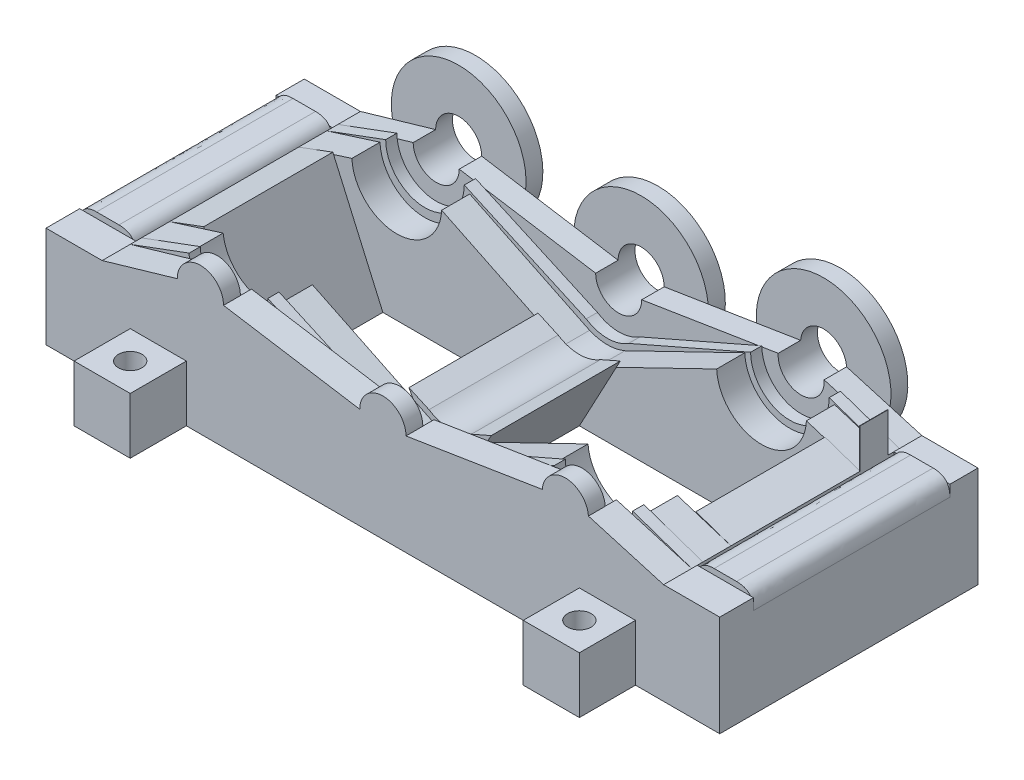
from build123d import *
from build123d.topology import SkipClean

# Parameters (mm, degrees)
SKETCH_1_5_W              = 10
SKETCH_1_5_H              = 10
SKETCH_1_5_R              = 2.1
EXTRUDE_4_DEPTH           = 10
EXTRUDE_4_2_DEPTH         = 10
SKETCH_1_6_W              = 10
SKETCH_1_6_H              = 10
SKETCH_1_6_R              = 2.1
EXTRUDE_5_DEPTH           = 35
SKETCH_1_W                = 10
SKETCH_1_H                = 35
EXTRUDE_7_DEPTH           = 19
EXTRUDE_7_2_DEPTH         = 19
FILLET_8_SIZE             = 3
FILLET_9_SIZE             = 3
EXTRUDE_8_DEPTH           = 18
SKETCH_2_W                = 37
SKETCH_2_H                = 30
CUT_EXTRUDE_2_DEPTH       = 138.800580637
CUT_EXTRUDE_3_DEPTH       = 113.111551644
CUT_EXTRUDE_3_DEPTH_BACK  = 113.111551644
CUT_EXTRUDE_6_DEPTH       = 138.800580637
CUT_EXTRUDE_6_DEPTH_BACK  = 138.800580637
EXTRUDE_START             = 3
SKETCH_13_R               = 12
SKETCH_13_R_2             = 4.1
SKETCH_13_R_3             = 4.10000036
EXTRUDE_20_DEPTH          = 3
CUT_EXTRUDE_9_DEPTH       = 40
EXTRUDE_21_DEPTH          = 5
CUT_EXTRUDE_10_DEPTH      = 5
EXTRUDE_START_2           = -6
EXTRUDE_22_DEPTH          = 6
CUT_EXTRUDE_START         = -6
CUT_EXTRUDE_11_DEPTH      = 6
SKETCH_16_R               = 4.12
EXTRUDE_45_DEPTH          = 3
CUT_EXTRUDE_12_DEPTH      = 36
CUT_EXTRUDE_12_DEPTH_BACK = 1
SKETCH_19_W               = 100
SKETCH_19_H               = 5
EXTRUDE_46_DEPTH          = 25
SKETCH_21_R               = 8
SKETCH_21_R_2             = 7.990611724
CUT_EXTRUDE_15_DEPTH      = 5
SKETCH_22_R               = 8
CUT_EXTRUDE_16_DEPTH      = 5
SKETCH_19_4_W             = 100
SKETCH_19_4_H             = 2
EXTRUDE_47_DEPTH          = 25
CUT_EXTRUDE_START_2       = -2
CUT_EXTRUDE_18_DEPTH      = 2
SKETCH_19_6_W             = 100
SKETCH_19_6_H             = 23
SKETCH_19_6_H_2           = 2
EXTRUDE_49_DEPTH          = 25
CUT_EXTRUDE_START_3       = -23
CUT_EXTRUDE_20_DEPTH      = 23
SKETCH_26_R               = 7
CUT_EXTRUDE_21_DEPTH      = 2
CUT_EXTRUDE_22_DEPTH      = 23


with BuildPart() as part:
    # Эскиз1<5> → Бобышка-Вытянуть4 (new body)
    with BuildSketch(Plane(origin=(0, 0, 0), x_dir=(1, 0, 0), z_dir=(0, 1, 0))):
        with Locations((-40, -35)):
            Rectangle(SKETCH_1_5_W, SKETCH_1_5_H)
        with Locations(Location((-40, -35, 0), (0, 0, 270))):
            Circle(SKETCH_1_5_R, mode=Mode.SUBTRACT)
    extrude(amount=EXTRUDE_4_DEPTH)



with BuildPart() as body_2:
    # Эскиз1<5> → Extrude 4 2 (new body)
    with BuildSketch(Plane(origin=(0, 0, 0), x_dir=(1, 0, 0), z_dir=(0, 1, 0))):
        with Locations((40, -35)):
            Rectangle(SKETCH_1_5_W, SKETCH_1_5_H)
        with Locations(Location((40, -35, 0), (0, 0, 270))):
            Circle(SKETCH_1_5_R, mode=Mode.SUBTRACT)
    extrude(amount=EXTRUDE_4_2_DEPTH)


with BuildPart() as body_3:
    # Эскиз1<6> → Бобышка-Вытянуть5 (new body)
    # profile 1 of 3: a face of its own
    with BuildSketch(Plane(origin=(0, 0, 0), x_dir=(1, 0, 0), z_dir=(0, 1, 0))):
        Polygon((45, 48), (35, 48), (-35, 48), (-45, 48), (-60, 48), (-60, 43), (-60, 16), (-55, 16), (-55, 43), (55, 43), (55, 16), (60, 16), (60, 43), (60, 48), align=None)
    # profile 2 of 3: a face of its own
    with BuildSketch(Plane(origin=(0, 0, 0), x_dir=(1, 0, 0), z_dir=(0, 1, 0))):
        with Locations((-40, 53)):
            Rectangle(SKETCH_1_6_W, SKETCH_1_6_H)
        with Locations(Location((-40, 53, 0), (0, 0, 270))):
            Circle(SKETCH_1_6_R, mode=Mode.SUBTRACT)
    # profile 3 of 3: a face of its own
    with BuildSketch(Plane(origin=(0, 0, 0), x_dir=(1, 0, 0), z_dir=(0, 1, 0))):
        with Locations((40, 53)):
            Rectangle(SKETCH_1_6_W, SKETCH_1_6_H)
        with Locations(Location((40, 53, 0), (0, 0, 270))):
            Circle(SKETCH_1_6_R, mode=Mode.SUBTRACT)
    extrude(amount=EXTRUDE_5_DEPTH)


with BuildPart() as body_4:
    # Эскиз1 → Бобышка-Вытянуть7 (new body)
    with BuildSketch(Plane(origin=(0, 0, 0), x_dir=(1, 0, 0), z_dir=(0, 1, 0))):
        with Locations((55, -6.5)):
            Rectangle(SKETCH_1_W, SKETCH_1_H)
    extrude(amount=EXTRUDE_7_DEPTH)

    # Скругление9
    # a fillet whose section is not a circle: 3 mm, written as the material it takes off along each edge
    with BuildSketch(Plane(origin=(50, 19, 31.5), x_dir=(0, -1, 0), z_dir=(0, 0, -1)), Plane(origin=(60, 19, -18.5), x_dir=(0, -1, 0), z_dir=(0, 0, 1))) as fillet_9_piece_1:
        with BuildLine():
            Bezier((FILLET_9_SIZE, 0), (0, 0), (0, -FILLET_9_SIZE), weights=[1, 1, 1])
            Line((0, -FILLET_9_SIZE), (0, 0))
            Line((0, 0), (FILLET_9_SIZE, 0))
        make_face()
    extrude(amount=50, mode=Mode.SUBTRACT)


with BuildPart() as body_5:
    # Эскиз1 → Extrude 7 2 (new body)
    with BuildSketch(Plane(origin=(0, 0, 0), x_dir=(1, 0, 0), z_dir=(0, 1, 0))):
        with Locations((-55, -6.5)):
            Rectangle(SKETCH_1_W, SKETCH_1_H)
    extrude(amount=EXTRUDE_7_2_DEPTH)

    # Скругление8
    # a fillet whose section is not a circle: 3 mm, written as the material it takes off along each edge
    with BuildSketch(Plane(origin=(-60, 19, -18.5), x_dir=(0, -1, 0), z_dir=(0, 0, 1)), Plane(origin=(-50, 19, 31.5), x_dir=(0, -1, 0), z_dir=(0, 0, -1))) as fillet_8_piece_1:
        with BuildLine():
            Bezier((FILLET_8_SIZE, 0), (0, 0), (0, FILLET_8_SIZE), weights=[1, 1, 1])
            Line((0, FILLET_8_SIZE), (0, 0))
            Line((0, 0), (FILLET_8_SIZE, 0))
        make_face()
    extrude(amount=50, mode=Mode.SUBTRACT)


with BuildPart() as part_1:
    add(part.part)

    add(body_2.part)  # Бобышка-Вытянуть8 merges body 2

    add(body_3.part)  # Бобышка-Вытянуть8 merges body 3

    add(body_4.part)  # Бобышка-Вытянуть8 merges body 4

    add(body_5.part)  # Бобышка-Вытянуть8 merges body 5
    # Эскиз1<9> → Бобышка-Вытянуть8 (add)
    with BuildSketch(Plane(origin=(0, 0, 0), x_dir=(1, 0, 0), z_dir=(0, 1, 0))):
        Polygon((-50, 11), (50, 11), (60, 11), (60, 16), (55, 16), (-55, 16), (-60, 16), (-60, 11), align=None)
        Polygon((50, -24), (60, -24), (60, -30), (45, -30), (35, -30), (-35, -30), (-45, -30), (-60, -30), (-60, -24), (-50, -24), align=None)
    extrude(amount=EXTRUDE_8_DEPTH)

    # Эскиз2 → Вырез-Вытянуть2 (cut, through all)
    with BuildSketch(Plane.ZY.offset(60)):
        with Locations((-39.5, 15)):
            Rectangle(SKETCH_2_W, SKETCH_2_H)
    extrude(amount=-CUT_EXTRUDE_2_DEPTH, mode=Mode.SUBTRACT)

    # Эскиз3 → Вырез-Вытянуть3 (cut, two sides: drawn at the far end of the back side and taken through both)
    with BuildSketch(Plane.XY.offset(30).offset(-CUT_EXTRUDE_3_DEPTH_BACK)):
        with BuildLine():
            Line((-4.1, 18), (4.1, 18))
            ThreePointArc((4.1, 18), (0, 13.9), (-4.1, 18))
        make_face()
    extrude(amount=CUT_EXTRUDE_3_DEPTH + CUT_EXTRUDE_3_DEPTH_BACK, mode=Mode.SUBTRACT)

    # Эскиз9 → Вырез-Вытянуть6 (cut, two sides: drawn at the far end of the back side and taken through both)
    with BuildSketch(Plane.ZY.offset(60).offset(-CUT_EXTRUDE_6_DEPTH_BACK)):
        Polygon((-58, 34.891965128), (-58, 35), (-16, 35), (-16, 34.9), align=None)
    extrude(amount=CUT_EXTRUDE_6_DEPTH + CUT_EXTRUDE_6_DEPTH_BACK, mode=Mode.SUBTRACT)

    # Эскиз13 → Бобышка-Вытянуть20 (add)
    # profile 1 of 3: a face of its own
    with BuildSketch(Plane(origin=(0, 0, -16), x_dir=(-1, 0, 0), z_dir=(0, 0, -1)).offset(EXTRUDE_START)):
        with Locations((0, 18)):
            Circle(SKETCH_13_R)
        with Locations((0, 18)):
            Circle(SKETCH_13_R_2, mode=Mode.SUBTRACT)
    # profile 2 of 3: a face of its own
    with BuildSketch(Plane(origin=(0, 0, -16), x_dir=(-1, 0, 0), z_dir=(0, 0, -1)).offset(EXTRUDE_START)):
        with Locations(Location((-32.500001, 21.606635135, 0), (0, 0, 197.490816275))):
            Circle(SKETCH_13_R)
        with Locations(Location((-32.500001, 21.606635135, 0), (0, 0, 241.602232684))):
            Circle(SKETCH_13_R_2, mode=Mode.SUBTRACT)
    # profile 3 of 3: a face of its own
    with BuildSketch(Plane(origin=(0, 0, -16), x_dir=(-1, 0, 0), z_dir=(0, 0, -1)).offset(EXTRUDE_START)):
        with Locations(Location((32.500001, 21.899999, 0), (0, 0, 198.96556994))):
            Circle(SKETCH_13_R)
        with Locations(Location((32.500001, 21.899999, 0), (0, 0, 252.030185321))):
            Circle(SKETCH_13_R_3, mode=Mode.SUBTRACT)
    extrude(amount=-EXTRUDE_20_DEPTH)

    # Эскиз14 → Вырез-Вытянуть9 (cut)
    with BuildSketch(Plane(origin=(0, 0, 0), x_dir=(-1, 0, 0), z_dir=(0, -1, 0))):
        Polygon((-55, 16), (-55, 43), (55, 43), (55, 16), (60, 16), (60, 63), (-60, 63), (-60, 16), align=None)
    extrude(amount=-CUT_EXTRUDE_9_DEPTH, mode=Mode.SUBTRACT)

    # Эскиз6 → Бобышка-Вытянуть21 (add)
    with BuildSketch(Plane(origin=(0, 0, -16), x_dir=(-1, 0, 0), z_dir=(0, 0, -1))):
        with BuildLine():
            ThreePointArc((-36.589492051, 21.9), (-36.094596608, 19.634610182), (-34.449919716, 18))
            Line((-34.449919716, 18), (-50, 18))
            Line((-50, 18), (-36.589492051, 21.9))
        make_face()
        with BuildLine():
            ThreePointArc((-30.550082284, 18), (-28.905405392, 19.634610182), (-28.410509949, 21.9))
            Line((-28.410509949, 21.9), (-4.1, 18))
            Line((-4.1, 18), (-30.550082284, 18))
        make_face()
        with BuildLine():
            ThreePointArc((28.40000064, 21.899999), (29.18366596, 19.489205592), (31.235085685, 18))
            Line((31.235085685, 18), (4.1, 18))
            Line((4.1, 18), (28.40000064, 21.899999))
        make_face()
        with BuildLine():
            ThreePointArc((33.764916315, 18), (35.81633604, 19.489205592), (36.60000136, 21.899999))
            Line((36.60000136, 21.899999), (50.000000511, 18))
            Line((50.000000511, 18), (33.764916315, 18))
        make_face()
    extrude(amount=-EXTRUDE_21_DEPTH)

    # Эскиз6<10> → Вырез-Вытянуть10 (cut)
    with SkipClean():  # the faces are left unmerged after this step: merging them gives an invalid solid
        with BuildSketch(Plane(origin=(0, 0, -16), x_dir=(-1, 0, 0), z_dir=(0, 0, -1))):
            with BuildLine():
                Line((-34.449919716, 18), (-30.550082284, 18))
                ThreePointArc((-30.550082284, 18), (-32.500001, 17.506635135), (-34.449919716, 18))
            make_face()
            with BuildLine():
                Line((31.235085685, 18), (33.764916315, 18))
                ThreePointArc((33.764916315, 18), (32.500001, 17.79999864), (31.235085685, 18))
            make_face()
        extrude(amount=-CUT_EXTRUDE_10_DEPTH, mode=Mode.SUBTRACT)

    # Эскиз15 → Бобышка-Вытянуть22 (add)
    with SkipClean():  # the faces are left unmerged after this step: merging them gives an invalid solid
        with BuildSketch(Plane.XY.offset(30).offset(EXTRUDE_START_2)):
            with BuildLine():
                ThreePointArc((-36.60000136, 21.899999), (-35.81633604, 19.489205592), (-33.764916315, 18))
                Line((-33.764916315, 18), (-50.000000511, 18))
                Line((-50.000000511, 18), (-36.60000136, 21.899999))
            make_face()
            with BuildLine():
                ThreePointArc((-31.235085685, 18), (-29.18366596, 19.489205592), (-28.40000064, 21.899999))
                Line((-28.40000064, 21.899999), (-4.1, 18))
                Line((-4.1, 18), (-31.235085685, 18))
            make_face()
            with BuildLine():
                ThreePointArc((28.410509949, 21.9), (28.89297398, 19.638162111), (30.525489547, 18))
                Line((30.525489547, 18), (4.1, 18))
                Line((4.1, 18), (28.410509949, 21.9))
            make_face()
            with BuildLine():
                ThreePointArc((34.461776796, 18), (36.097990551, 19.637740804), (36.589492051, 21.9))
                Line((36.589492051, 21.9), (50, 18))
                Line((50, 18), (34.461776796, 18))
            make_face()
        extrude(amount=EXTRUDE_22_DEPTH)

    # Эскиз15<4> → Вырез-Вытянуть11 (cut)
    with SkipClean():  # the faces are left unmerged after this step: merging them gives an invalid solid
        with BuildSketch(Plane.XY.offset(30).offset(CUT_EXTRUDE_START)):
            with BuildLine():
                ThreePointArc((-31.235085685, 18), (-32.500001, 17.79999864), (-33.764916315, 18))
                Line((-33.764916315, 18), (-31.235085685, 18))
            make_face()
            with BuildLine():
                Line((30.525489547, 18), (34.461776796, 18))
                ThreePointArc((34.461776796, 18), (32.493633171, 17.49706569), (30.525489547, 18))
            make_face()
        extrude(amount=CUT_EXTRUDE_11_DEPTH, mode=Mode.SUBTRACT)

    # Эскиз16 → Бобышка-Вытянуть45 (add)
    with SkipClean():  # the faces are left unmerged after this step: merging them gives an invalid solid
        with BuildSketch(Plane.XY.offset(30)):
            with Locations((-32.500001, 21.899999)):
                Circle(SKETCH_16_R)
            with Locations((-1e-06, 17.999999)):
                Circle(SKETCH_16_R)
            with Locations((32.500001, 21.606635135)):
                Circle(SKETCH_16_R)
        extrude(amount=-EXTRUDE_45_DEPTH)

    # Эскиз18 → Вырез-Вытянуть12 (cut, two sides: drawn at the far end of the back side and taken through both)
    with SkipClean():  # the faces are left unmerged after this step: merging them gives an invalid solid
        with BuildSketch(Plane(origin=(0, 0, 24), x_dir=(-1, 0, 0), z_dir=(0, 0, -1)).offset(-CUT_EXTRUDE_12_DEPTH_BACK)):
            with BuildLine():
                Line((-50, 18), (-50, 0))
                Line((-50, 0), (50, 0))
                Line((50, 0), (50.000000511, 18))
                Line((50.000000511, 18), (38.963499742, 21.212115276))
                ThreePointArc((38.963499742, 21.212115276), (32.347223741, 15.401794701), (26.01131637, 21.516630028))
                Line((26.01131637, 21.516630028), (6.488685559, 18.383369179))
                ThreePointArc((6.488685559, 18.383369179), (8.334e-05, 11.499999001), (-6.48869327, 18.383204786))
                Line((-6.48869327, 18.383204786), (-26.000624178, 21.516630028))
                ThreePointArc((-26.000624178, 21.516630028), (-32.347637702, 15.108421117), (-38.98801719, 21.212115276))
                Line((-38.98801719, 21.212115276), (-50, 18))
            make_face()
        extrude(amount=CUT_EXTRUDE_12_DEPTH + CUT_EXTRUDE_12_DEPTH_BACK, mode=Mode.SUBTRACT)

    # Эскиз19 → Бобышка-Вытянуть46 (add)
    with SkipClean():  # the faces are left unmerged after this step: merging them gives an invalid solid
        with BuildSketch(Plane(origin=(0, 0, 0), x_dir=(-1, 0, 0), z_dir=(0, -1, 0))):
            with Locations((0, 7.5)):
                Rectangle(SKETCH_19_W, SKETCH_19_H)
            with Locations((0, -20.5)):
                Rectangle(SKETCH_19_W, SKETCH_19_H)
        extrude(amount=-EXTRUDE_46_DEPTH)

    # Эскиз21 → Вырез-Вытянуть15 (cut)
    with SkipClean():  # the faces are left unmerged after this step: merging them gives an invalid solid
        with BuildSketch(Plane.XY.offset(23)):
            with BuildLine():
                ThreePointArc((-24.500001, 21.899999), (-24.512903633, 21.445823206), (-24.551569913, 20.993112428))
                Line((-24.551569913, 20.993112428), (-3.755557816, 10.903257929))
                ThreePointArc((-3.755557816, 10.903257929), (-4.142092874, 24.878299352), (8.029192037, 17.999999))
                ThreePointArc((8.029192037, 17.999999), (6.90059973, 13.895166434), (3.832095188, 10.944293533))
                Line((3.832095188, 10.944293533), (24.534400562, 20.974903085))
                ThreePointArc((24.534400562, 20.974903085), (32.183887512, 29.59099159), (40.490612724, 21.606635135))
                ThreePointArc((40.490612724, 21.606635135), (40.484790375, 21.301652579), (40.467331813, 20.997114472))
                Line((40.467331813, 20.997114472), (50, 18))
                Line((50, 18), (50, 32.99688366))
                Line((50, 32.99688366), (-50.000000511, 32.99688366))
                Line((-50.000000511, 32.99688366), (-50.000000511, 18))
                Line((-50.000000511, 18), (-40.450461326, 21.011077968))
                ThreePointArc((-40.450461326, 21.011077968), (-32.945151194, 29.88760448), (-24.500001, 21.899999))
            make_face()
            with BuildLine():
                ThreePointArc((8.029192037, 17.999999), (-4.142092874, 24.878299352), (-3.755557816, 10.903257929))
                Line((-3.755557816, 10.903257929), (-3.249901243, 10.65792237))
                ThreePointArc((-3.249901243, 10.65792237), (-0.047751084, 9.97094795), (3.162343382, 10.6197877))
                Line((3.162343382, 10.6197877), (3.832095188, 10.944293533))
                ThreePointArc((3.832095188, 10.944293533), (6.90059973, 13.895166434), (8.029192037, 17.999999))
            make_face()
            with Locations((-32.500001, 21.899999)):
                Circle(SKETCH_21_R)
            with Locations((32.500001, 21.606635135)):
                Circle(SKETCH_21_R_2)
        extrude(amount=-CUT_EXTRUDE_15_DEPTH, mode=Mode.SUBTRACT)

    # Эскиз22 → Вырез-Вытянуть16 (cut)
    with SkipClean():  # the faces are left unmerged after this step: merging them gives an invalid solid
        with BuildSketch(Plane.XY.offset(-5)):
            with BuildLine():
                ThreePointArc((-24.523403373, 21.352950715), (-24.52535103, 21.176432383), (-24.531193053, 21))
                Line((-24.531193053, 21), (-3.854352274, 10.972661373))
                ThreePointArc((-3.854352274, 10.972661373), (-4.11866147, 24.876962286), (7.968803904, 17.999999))
                ThreePointArc((7.968803904, 17.999999), (6.846940406, 13.914507841), (3.795994342, 10.97485755))
                Line((3.795994342, 10.97485755), (24.453194531, 21))
                ThreePointArc((24.453194531, 21), (32.26888649, 29.35100311), (40.445404848, 21.352950768))
                ThreePointArc((40.445404848, 21.352950768), (40.443457191, 21.176432409), (40.437615166, 21))
                Line((40.437615166, 21), (49.937612445, 18))
                Line((49.937612445, 18), (49.937612445, 32.99688366))
                Line((49.937612445, 32.99688366), (-50.000000511, 32.99688366))
                Line((-50.000000511, 32.99688366), (-50.000000511, 18))
                Line((-50.000000511, 18), (-40.515613693, 21))
                ThreePointArc((-40.515613693, 21), (-32.699921705, 29.351003058), (-24.523403373, 21.352950715))
            make_face()
            with Locations((32.445404848, 21.352950768)):
                Circle(SKETCH_22_R)
            with BuildLine():
                ThreePointArc((7.968803904, 17.999999), (-4.11866147, 24.876962286), (-3.854352274, 10.972661373))
                Line((-3.854352274, 10.972661373), (-3.18204078, 10.646620511))
                ThreePointArc((-3.18204078, 10.646620511), (-0.031195062, 9.999999115), (3.119650509, 10.646621235))
                Line((3.119650509, 10.646621235), (3.795994342, 10.97485755))
                ThreePointArc((3.795994342, 10.97485755), (6.846940406, 13.914507841), (7.968803904, 17.999999))
            make_face()
            with Locations((-32.523403373, 21.352950715)):
                Circle(SKETCH_22_R)
        extrude(amount=-CUT_EXTRUDE_16_DEPTH, mode=Mode.SUBTRACT)


with BuildPart() as extrude_47_tool:
    # Эскиз19<4> → Бобышка-Вытянуть47 (new body)
    with SkipClean():  # the faces are left unmerged after this step: merging them gives an invalid solid
        with BuildSketch(Plane(origin=(0, 0, 0), x_dir=(-1, 0, 0), z_dir=(0, -1, 0))):
            with Locations((0, 11)):
                Rectangle(SKETCH_19_4_W, SKETCH_19_4_H)
        extrude(amount=-EXTRUDE_47_DEPTH)


with BuildPart() as part_2:
    with SkipClean():  # the faces are left unmerged after this step: merging them gives an invalid solid
        add(part_1.part)


with BuildPart() as part_3:
    # Бобышка-Вытянуть47: joined with extrude_47_tool
    with SkipClean():  # the faces are left unmerged after this step: merging them gives an invalid solid
        add(part_2.part.fuse(extrude_47_tool.part, tol=0.00001))

    # Вырез-Вытянуть18: read off the stored shape, not the designer's step
    # Вырез-Вытянуть18 outline → Вырез-Вытянуть18 (cut)
    with SkipClean():  # the faces are left unmerged after this step: merging them gives an invalid solid
        with BuildSketch(Plane.XY.offset(-10).offset(CUT_EXTRUDE_START_2)):
            with BuildLine():
                ThreePointArc((-3.786737072, 12.11267109), (-1.59e-07, 10.999999), (3.786736487, 12.112672))
                Line((3.786736487, 12.112672), (25.500001, 21.606635135))
                ThreePointArc((25.500001, 21.606635135), (32.500001, 14.606635135), (39.500001, 21.606635135))
                Line((39.500001, 21.606635135), (50, 18))
                Line((50, 18), (50, 25))
                Line((50, 25), (-50, 25))
                Line((-50, 25), (-50, 18))
                Line((-50, 18), (-39.500001, 21.899999))
                ThreePointArc((-39.500001, 21.899999), (-32.500001, 14.899999), (-25.500001, 21.899999))
                Line((-25.500001, 21.899999), (-3.786737072, 12.11267109))
            make_face()
        extrude(amount=CUT_EXTRUDE_18_DEPTH, mode=Mode.SUBTRACT)


with BuildPart() as extrude_49_tool:
    # Эскиз19<6> → Бобышка-Вытянуть49 (new body)
    with SkipClean():  # the faces are left unmerged after this step: merging them gives an invalid solid
        with BuildSketch(Plane(origin=(0, 0, 0), x_dir=(-1, 0, 0), z_dir=(0, -1, 0))):
            with Locations((0, -6.5)):
                Rectangle(SKETCH_19_6_W, SKETCH_19_6_H)
            with Locations((0, -24)):
                Rectangle(SKETCH_19_6_W, SKETCH_19_6_H_2)
        extrude(amount=-EXTRUDE_49_DEPTH)


with BuildPart() as part_4:
    with SkipClean():  # the faces are left unmerged after this step: merging them gives an invalid solid
        add(part_3.part)


with BuildPart() as part_5:
    # Бобышка-Вытянуть49: joined with extrude_49_tool
    with SkipClean():  # the faces are left unmerged after this step: merging them gives an invalid solid
        add(part_4.part.fuse(extrude_49_tool.part, tol=0.00001))

    # Вырез-Вытянуть20: read off the stored shape, not the designer's step
    # Вырез-Вытянуть20 outline → Вырез-Вытянуть20 (cut)
    with SkipClean():  # the faces are left unmerged after this step: merging them gives an invalid solid
        with BuildSketch(Plane.XY.offset(18).offset(CUT_EXTRUDE_START_3)):
            with BuildLine():
                ThreePointArc((-3.786737072, 12.11267109), (-1.59e-07, 10.999999), (3.786736487, 12.112672))
                Line((3.786736487, 12.112672), (25.500001, 21.606635135))
                ThreePointArc((25.500001, 21.606635135), (32.500001, 14.606635135), (39.500001, 21.606635135))
                Line((39.500001, 21.606635135), (50, 18))
                Line((50, 18), (50, 25))
                Line((50, 25), (-50, 25))
                Line((-50, 25), (-50, 18))
                Line((-50, 18), (-39.500001, 21.899999))
                ThreePointArc((-39.500001, 21.899999), (-32.500001, 14.899999), (-25.500001, 21.899999))
                Line((-25.500001, 21.899999), (-3.786737072, 12.11267109))
            make_face()
        extrude(amount=CUT_EXTRUDE_20_DEPTH, mode=Mode.SUBTRACT)

    # Эскиз26 → Вырез-Вытянуть21 (cut)
    with SkipClean():  # the faces are left unmerged after this step: merging them gives an invalid solid
        with BuildSketch(Plane.XY.offset(25).offset(CUT_EXTRUDE_START_2)):
            with BuildLine():
                ThreePointArc((-39.500001, 21.899999), (-32.500001, 28.899999), (-25.500001, 21.899999))
                Line((-25.500001, 21.899999), (-3.786737072, 12.11267109))
                ThreePointArc((-3.786737072, 12.11267109), (-3.353569808, 24.144392888), (6.999999, 17.999999))
                ThreePointArc((6.999999, 17.999999), (6.144393291, 14.646430931), (3.786736487, 12.112672))
                Line((3.786736487, 12.112672), (25.500001, 21.606635135))
                ThreePointArc((25.500001, 21.606635135), (32.500001, 28.606635135), (39.500001, 21.606635135))
                Line((39.500001, 21.606635135), (50, 18))
                Line((50, 18), (50, 33))
                Line((50, 33), (-50.000000511, 33))
                Line((-50.000000511, 33), (-50.000000511, 18))
                Line((-50.000000511, 18), (-39.500001, 21.899999))
            make_face()
            with Locations((-32.500001, 21.899999)):
                Circle(SKETCH_26_R)
            with Locations((-1e-06, 17.999999)):
                Circle(SKETCH_26_R)
            with Locations((32.500001, 21.606635135)):
                Circle(SKETCH_26_R)
        extrude(amount=CUT_EXTRUDE_21_DEPTH, mode=Mode.SUBTRACT)

    # Эскиз27 → Вырез-Вытянуть22 (cut)
    with SkipClean():  # the faces are left unmerged after this step: merging them gives an invalid solid
        with BuildSketch(Plane.XY.offset(18)):
            Polygon((-22.630718172, 23.475525811), (-45.865164194, 24.703049148), (-35, 0), (0, 0), (-10.173796037, 18.974806496), align=None)
            Polygon((10.1388467, 18.968778614), (0, 0), (35, 0), (45.723941053, 24.677497529), (21.135686228, 23.475525811), align=None)
        extrude(amount=-CUT_EXTRUDE_22_DEPTH, mode=Mode.SUBTRACT)


solid = part_5.part
